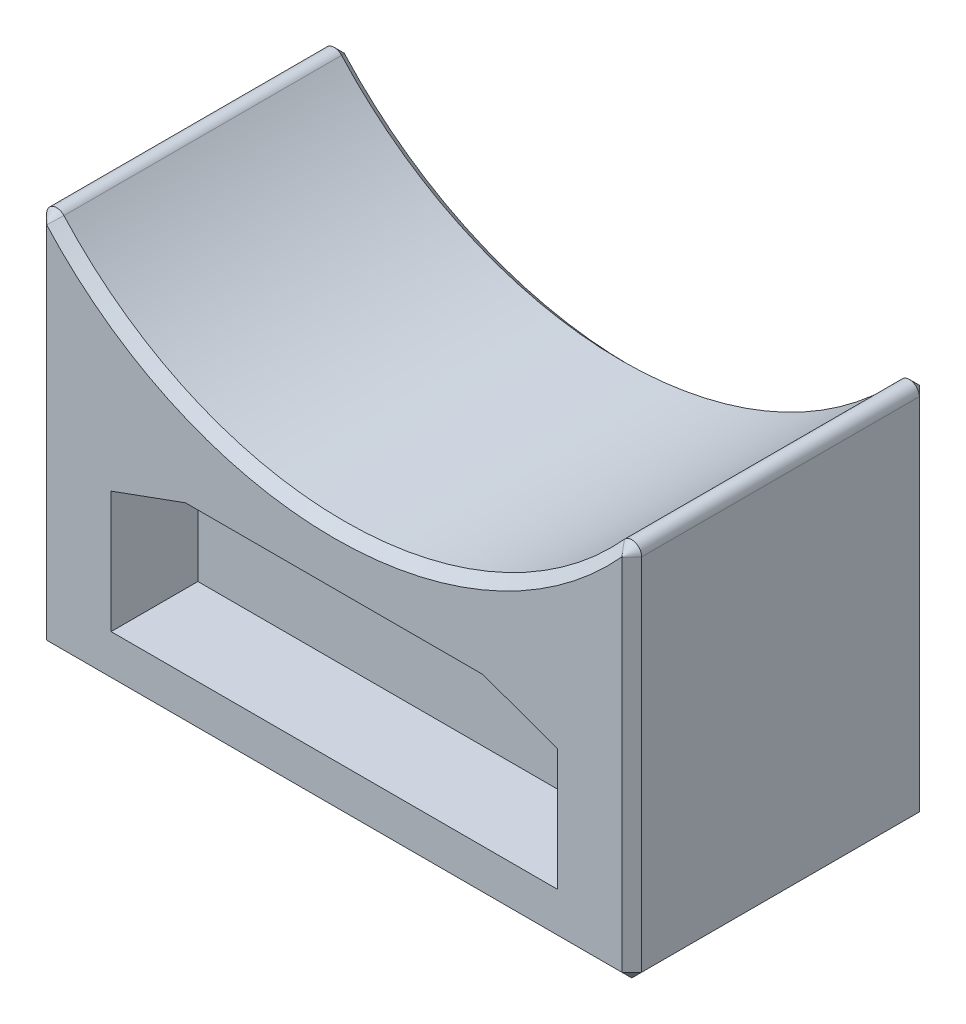
from build123d import *
from OCP.BRepFilletAPI import BRepFilletAPI_MakeChamfer

# Parameters (mm, degrees)
BOSS_EXTRUDE1_DEPTH        = 60
FILLET1_R                  = 2
CHAMFER1_SIZE              = 2
SKETCH2_W                  = 90
SKETCH2_H                  = 30
CUT_EXTRUDE1_DEPTH         = 17.5
CHAMFER2_SIZE              = 15
CHAMFER2_SIZE_2            = 5.459553514
CHAMFER2_OF_MIRROR2_SIZE   = 15
CHAMFER2_OF_MIRROR2_SIZE_2 = 5.459553514


with BuildPart() as part:
    # Sketch1 → Boss-Extrude1 (new body)
    with BuildSketch(Plane.XY):
        with BuildLine():
            Line((0, -76.2), (0, -127))
            Line((0, -127), (60, -127))
            Line((60, -127), (60, -46.972758063))
            ThreePointArc((60, -46.972758063), (33.37001525, -68.504613583), (0, -76.2))
        make_face()
    boss_extrude1 = extrude(amount=BOSS_EXTRUDE1_DEPTH)

    # Mirror1: Boss-Extrude1 across plane
    add(boss_extrude1.mirror(Plane(origin=(0, -76.2, 60), x_dir=(0, 0, 1), z_dir=(1, 0, 0))))

    # Fillet1
    fillet1_edges = [part.edges().sort_by_distance(p)[0] for p in [
        (-60, -46.972758063, 30),
        (60, -46.972758063, 30),
    ]]
    fillet(fillet1_edges, radius=FILLET1_R)

    # Chamfer1
    chamfer1_edges = [part.edges().sort_by_distance(p)[0] for p in [
        (-60, -127, 30),
        (-60, -89.726132006, 60),
        (-60, -89.726132006, 0),
        (0, -76.2, 0),
        (0, -76.2, 60),
        (-58.718765637, -50.585883569, 0),
        (58.718765637, -50.585883569, 0),
        (-58.718765637, -50.585883569, 60),
        (58.718765637, -50.585883569, 60),
        (0, -127, 60),
        (60, -89.726132006, 0),
        (0, -127, 0),
        (60, -127, 30),
        (60, -89.726132006, 60),
    ]]
    chamfer(chamfer1_edges, length=CHAMFER1_SIZE)

    # Sketch2 → Cut-Extrude1 (cut)
    with BuildSketch(Plane(origin=(0, 0, 0), x_dir=(-1, 0, 0), z_dir=(0, 0, -1))):
        with Locations((0, -102)):
            Rectangle(SKETCH2_W, SKETCH2_H)
    cut_extrude1 = extrude(amount=-CUT_EXTRUDE1_DEPTH, mode=Mode.SUBTRACT)

    # Chamfer2
    chamfer2_edges_1 = [part.edges().sort_by_distance(p)[0] for p in [
        (-45, -87, 8.75),
    ]]
    chamfer2_side_1 = [part.faces().sort_by_distance(p)[0] for p in [
        (-44.89080893, -87, 8.75),
    ]]
    chamfer2_edges_2 = [part.edges().sort_by_distance(p)[0] for p in [
        (0, -87, 17.5),
    ]]
    chamfer2_side_2 = [part.faces().sort_by_distance(p)[0] for p in [
        (0, -87, 17.39080893),
    ]]
    chamfer2_edges_3 = [part.edges().sort_by_distance(p)[0] for p in [
        (45, -87, 8.75),
    ]]
    chamfer2_side_3 = [part.faces().sort_by_distance(p)[0] for p in [
        (45, -87.10919107, 8.75),
    ]]
    chamfer2 = BRepFilletAPI_MakeChamfer(part.part.solid().wrapped)
    for e in chamfer2_edges_1:
        chamfer2.Add(CHAMFER2_SIZE - 0.0001, CHAMFER2_SIZE_2 - 0.0001, e.wrapped, chamfer2_side_1[0].wrapped)
    for e in chamfer2_edges_2:
        chamfer2.Add(CHAMFER2_SIZE - 0.0001, CHAMFER2_SIZE_2 - 0.0001, e.wrapped, chamfer2_side_2[0].wrapped)
    for e in chamfer2_edges_3:
        chamfer2.Add(CHAMFER2_SIZE_2 - 0.0001, CHAMFER2_SIZE - 0.0001, e.wrapped, chamfer2_side_3[0].wrapped)
    add(Compound.cast(chamfer2.Shape()), mode=Mode.REPLACE)  # a hair under: the kernel refuses the full size

    # Mirror2: Cut-Extrude1 across plane
    add(cut_extrude1.mirror(Plane(origin=(0, 0, 30), x_dir=(1, 0, 0), z_dir=(0, 0, -1))), mode=Mode.SUBTRACT)

    # Chamfer2 of Mirror2
    chamfer2_of_mirror2_edges_1 = [part.edges().sort_by_distance(p)[0] for p in [
        (-45, -87, 51.25),
    ]]
    chamfer2_of_mirror2_side_1 = [part.faces().sort_by_distance(p)[0] for p in [
        (-44.89080893, -87, 51.25),
    ]]
    chamfer2_of_mirror2_edges_2 = [part.edges().sort_by_distance(p)[0] for p in [
        (0, -87, 42.5),
    ]]
    chamfer2_of_mirror2_side_2 = [part.faces().sort_by_distance(p)[0] for p in [
        (0, -87, 42.60919107),
    ]]
    chamfer2_of_mirror2_edges_3 = [part.edges().sort_by_distance(p)[0] for p in [
        (45, -87, 51.25),
    ]]
    chamfer2_of_mirror2_side_3 = [part.faces().sort_by_distance(p)[0] for p in [
        (45, -87.10919107, 51.25),
    ]]
    chamfer2_of_mirror2 = BRepFilletAPI_MakeChamfer(part.part.solid().wrapped)
    for e in chamfer2_of_mirror2_edges_1:
        chamfer2_of_mirror2.Add(CHAMFER2_OF_MIRROR2_SIZE - 0.0001, CHAMFER2_OF_MIRROR2_SIZE_2 - 0.0001, e.wrapped, chamfer2_of_mirror2_side_1[0].wrapped)
    for e in chamfer2_of_mirror2_edges_2:
        chamfer2_of_mirror2.Add(CHAMFER2_OF_MIRROR2_SIZE - 0.0001, CHAMFER2_OF_MIRROR2_SIZE_2 - 0.0001, e.wrapped, chamfer2_of_mirror2_side_2[0].wrapped)
    for e in chamfer2_of_mirror2_edges_3:
        chamfer2_of_mirror2.Add(CHAMFER2_OF_MIRROR2_SIZE_2 - 0.0001, CHAMFER2_OF_MIRROR2_SIZE - 0.0001, e.wrapped, chamfer2_of_mirror2_side_3[0].wrapped)
    add(Compound.cast(chamfer2_of_mirror2.Shape()), mode=Mode.REPLACE)  # a hair under: the kernel refuses the full size


solid = part.part
